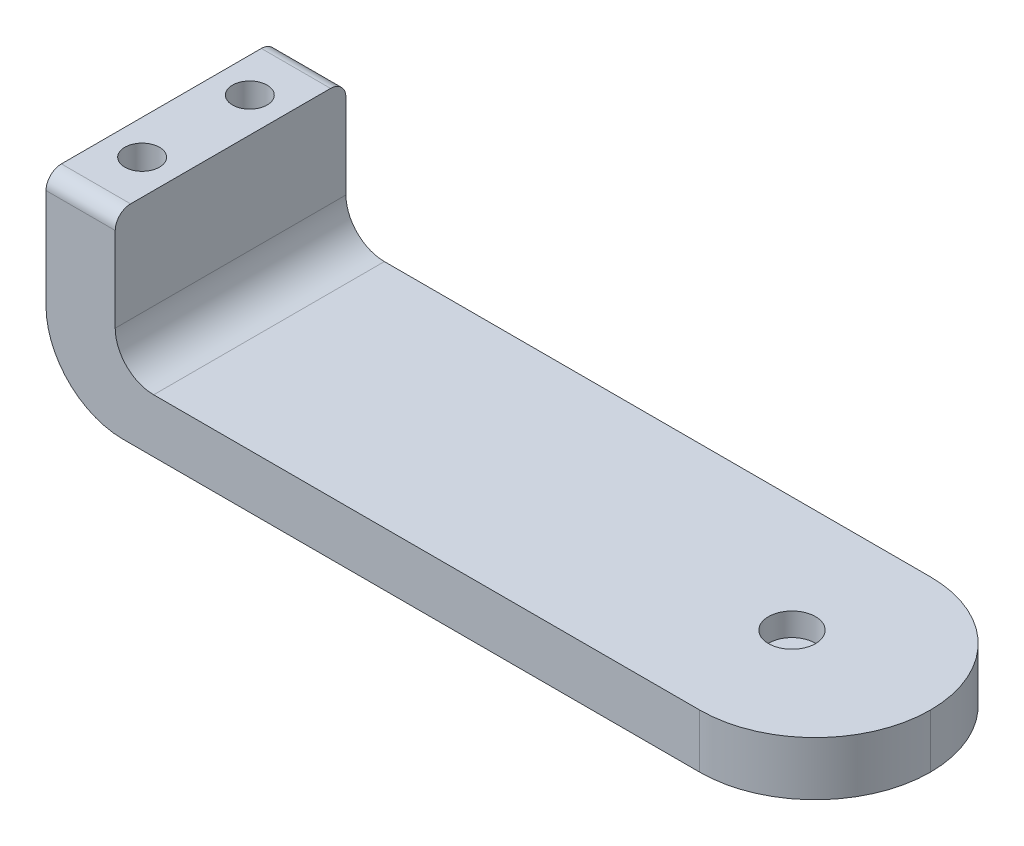
from build123d import *

# Parameters (mm, degrees)
BOSS_EXTRUDE1_DEPTH = 30
SKETCH2_R           = 2.25
CUT_EXTRUDE1_DEPTH  = 6
FILLET1_R           = 5
FILLET2_R           = 10
SKETCH3_R           = 3.05
CUT_EXTRUDE3_DEPTH  = 3
FILLET3_R           = 15
FILLET4_R           = 2


with BuildPart() as part:
    # Sketch1 → Boss-Extrude1 (new body)
    with BuildSketch(Plane.XY):
        Polygon((-4.5, 21.5), (4.5, 21.5), (4.5, 3.5), (95.5, 3.5), (95.5, -3.5), (-4.5, -3.5), align=None)
    extrude(amount=BOSS_EXTRUDE1_DEPTH)

    # Sketch2 → Cut-Extrude1 (cut)
    with BuildSketch(Plane(origin=(0, 21.5, 0), x_dir=(1, 0, 0), z_dir=(0, 1, 0))):
        with Locations(Location((0, -22, 0), (0, 0, 270))):
            Circle(SKETCH2_R)
        with Locations(Location((0, -8, 0), (0, 0, 270))):
            Circle(SKETCH2_R)
    extrude(amount=-CUT_EXTRUDE1_DEPTH, mode=Mode.SUBTRACT)

    # Fillet1
    fillet1_edges = [part.edges().sort_by_distance(p)[0] for p in [
        (4.5, 3.5, 15),
    ]]
    fillet(fillet1_edges, radius=FILLET1_R)

    # Fillet2
    fillet2_edges = [part.edges().sort_by_distance(p)[0] for p in [
        (-4.5, -3.5, 15),
    ]]
    fillet(fillet2_edges, radius=FILLET2_R)

    # Sketch3 → Cut-Extrude3 (cut)
    with BuildSketch(Plane.XZ.offset(-3.5)):
        with Locations((77.5, 15)):
            Circle(SKETCH3_R)
    extrude(amount=CUT_EXTRUDE3_DEPTH, mode=Mode.SUBTRACT)

    # Fillet3
    fillet3_edges = [part.edges().sort_by_distance(p)[0] for p in [
        (95.5, 0, 30),
        (95.5, 0, 0),
    ]]
    fillet(fillet3_edges, radius=FILLET3_R - 0.0001)  # a hair under: the kernel refuses the full size

    # Fillet4
    fillet4_edges = [part.edges().sort_by_distance(p)[0] for p in [
        (0, 21.5, 30),
        (0, 21.5, 0),
    ]]
    fillet(fillet4_edges, radius=FILLET4_R)


solid = part.part
